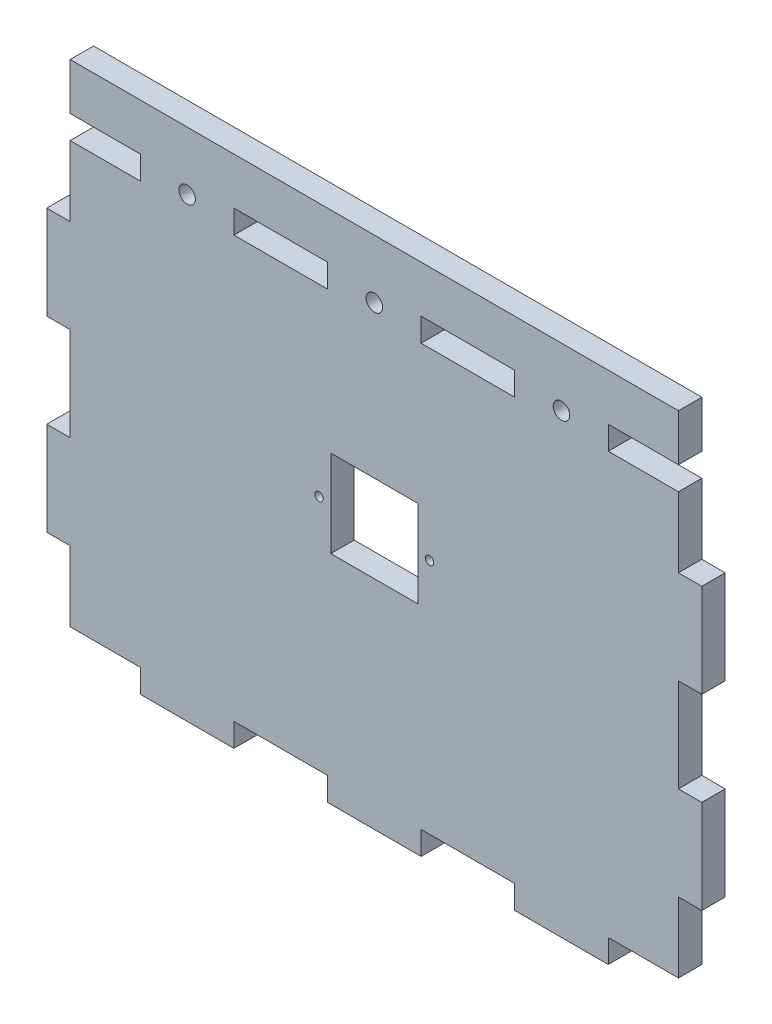
from build123d import *

# Parameters (mm, degrees)
SKETCH1_W                 = 177.8
SKETCH1_H                 = 139.7
BOSS_EXTRUDE1_DEPTH       = 6.35
SKETCH5_W                 = 6.35
SKETCH5_H                 = 25.4
CUT_EXTRUDE4_DEPTH        = 6.35
SKETCH6_W                 = 25.4
SKETCH6_H                 = 6.35
CUT_EXTRUDE5_DEPTH        = 6.35
LPATTERN5_COUNT           = 3
LPATTERN5_PITCH           = 50.8
LPATTERN5_COUNT_DIR2      = 2
LPATTERN5_PITCH_DIR2      = 171.45
LPATTERN6_COUNT           = 4
LPATTERN6_PITCH           = 50.8
LPATTERN6_COUNT_DIR2      = 2
LPATTERN6_PITCH_DIR2      = 120.65
SKETCH7_W                 = 6.35
SKETCH7_H                 = 19.05
CUT_EXTRUDE6_DEPTH        = 6.35
SKETCH12_W                = 6.35
SKETCH12_H                = 12.7
CUT_EXTRUDE9_DEPTH        = 7.62
F_8_CLEARANCE_HOLE1_D     = 4.4958
F_8_CLEARANCE_HOLE1_DEPTH = 10.16
F_8_CLEARANCE_HOLE1_TIP   = 1.350674586
SKETCH11_R                = 1.143
SKETCH11_W                = 23.622
SKETCH11_H                = 23.622
CUT_EXTRUDE8_DEPTH        = 7.62


with BuildPart() as part:
    # Sketch1 → Boss-Extrude1 (new body)
    with BuildSketch(Plane.XY):
        with Locations((88.9, 69.85)):
            Rectangle(SKETCH1_W, SKETCH1_H)
    extrude(amount=BOSS_EXTRUDE1_DEPTH)

    # Sketch5 → Cut-Extrude4 (cut)
    with BuildSketch(Plane.XY.offset(6.35)):
        with Locations((3.175, 12.7)):
            Rectangle(SKETCH5_W, SKETCH5_H)
    cut_extrude4 = extrude(amount=-CUT_EXTRUDE4_DEPTH, mode=Mode.SUBTRACT)

    # Sketch6 → Cut-Extrude5 (cut)
    with BuildSketch(Plane.XY.offset(6.35)):
        with Locations((12.7, 3.175)):
            Rectangle(SKETCH6_W, SKETCH6_H)
    cut_extrude5 = extrude(amount=-CUT_EXTRUDE5_DEPTH, mode=Mode.SUBTRACT)

    # LPattern5: Cut-Extrude4 3 × 2
    with Locations(*[(j * LPATTERN5_PITCH_DIR2, i * LPATTERN5_PITCH, 0) for i in range(LPATTERN5_COUNT) for j in range(LPATTERN5_COUNT_DIR2) if (i, j) != (0, 0)]):
        add(cut_extrude4, mode=Mode.SUBTRACT)

    # LPattern6: Cut-Extrude5 4 × 2
    with Locations(*[(i * LPATTERN6_PITCH, j * LPATTERN6_PITCH_DIR2, 0) for i in range(LPATTERN6_COUNT) for j in range(LPATTERN6_COUNT_DIR2) if (i, j) != (0, 0)]):
        add(cut_extrude5, mode=Mode.SUBTRACT)

    # Sketch7 → Cut-Extrude6 (cut)
    with BuildSketch(Plane.XY.offset(6.35)):
        with Locations((3.175, 130.175)):
            Rectangle(SKETCH7_W, SKETCH7_H)
    extrude(amount=-CUT_EXTRUDE6_DEPTH, mode=Mode.SUBTRACT)

    # Sketch12 → Cut-Extrude9 (cut)
    with BuildSketch(Plane.XY.offset(6.35)):
        with Locations((174.625, 133.35)):
            Rectangle(SKETCH12_W, SKETCH12_H)
    extrude(amount=-CUT_EXTRUDE9_DEPTH, mode=Mode.SUBTRACT)

    # #8 Clearance Hole1
    with Locations(Plane.XY.offset(6.35)):
        with Locations((38.1, 123.825), (88.9, 123.825), (139.7, 123.825)):
            Hole(F_8_CLEARANCE_HOLE1_D / 2, depth=F_8_CLEARANCE_HOLE1_DEPTH)
            with Locations((0, 0, -(F_8_CLEARANCE_HOLE1_DEPTH + F_8_CLEARANCE_HOLE1_TIP / 2))):  # 118° drill point
                Cone(0, F_8_CLEARANCE_HOLE1_D / 2, F_8_CLEARANCE_HOLE1_TIP, mode=Mode.SUBTRACT)

    # Sketch11 → Cut-Extrude8 (cut)
    with BuildSketch(Plane.XY.offset(6.35)):
        with Locations((73.914, 70.739)):
            Circle(SKETCH11_R)
        with Locations((103.886, 70.739)):
            Circle(SKETCH11_R)
        with Locations((88.9, 70.739)):
            Rectangle(SKETCH11_W, SKETCH11_H)
    extrude(amount=-CUT_EXTRUDE8_DEPTH, mode=Mode.SUBTRACT)


solid = part.part
